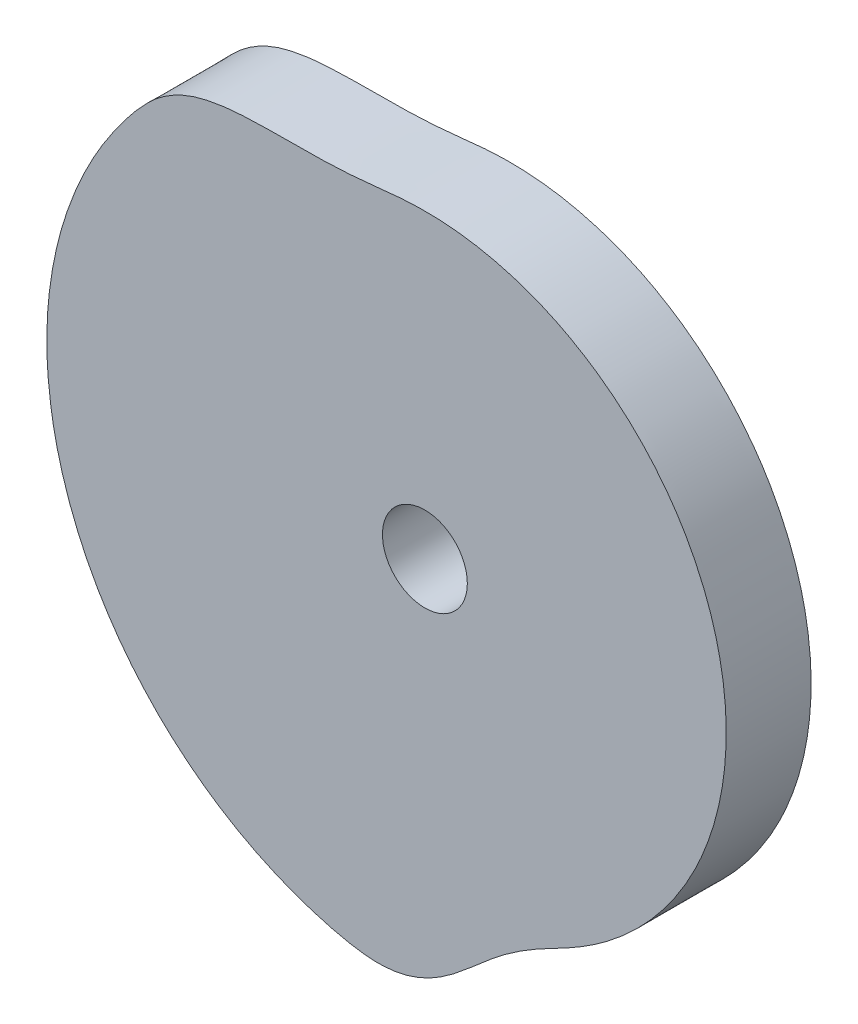
from build123d import *

# Parameters (mm, degrees)
SKETCH_1_R      = 10
EXTRUDE_1_DEPTH = 20


with BuildPart() as part:
    # 草图1 → 凸台-拉伸1 (new body)
    with BuildSketch(Plane.XY):
        with BuildLine():
            add(Edge.make_bspline(
                [(-55.64, -69.55), (-55.438072692, -69.711746946), (-55.028587824, -70.028203229), (-54.422364936, -70.514043862), (-53.798625861, -70.978190756), (-53.182107782, -71.453969938), (-52.549099836, -71.908791849), (-51.922508415, -72.370105147), (-51.291253069, -72.823230811), (-50.649377434, -73.259106602), (-50.008296576, -73.702367653), (-49.366891024, -74.138684997), (-48.713375963, -74.563395362), (-48.067007728, -74.989058095), (-47.407738113, -75.401723626), (-46.748284804, -75.812626567), (-46.083726707, -76.217298839), (-45.420757194, -76.623545995), (-44.747649559, -77.011728292), (-44.074066423, -77.397932034), (-43.396153141, -77.785057519), (-42.713672599, -78.157271781), (-42.030613475, -78.534073514), (-41.339344205, -78.888767981), (-40.65213613, -79.250771253), (-39.960248499, -79.603916517), (-39.261492289, -79.936236322), (-38.565896047, -80.285271505), (-37.863886563, -80.617834529), (-37.159747216, -80.953318034), (-36.452002287, -81.271225613), (-35.739415568, -81.578635341), (-35.029970337, -81.894412541), (-34.309383739, -82.188542724), (-33.592031011, -82.491589222), (-32.871808916, -82.781270726), (-32.146994805, -83.060827753), (-31.422152669, -83.342408661), (-30.689196931, -83.607774285), (-29.964253719, -83.885294388), (-29.224510345, -84.127134892), (-28.496752176, -84.393362771), (-27.756590493, -84.629814315), (-27.0217978, -84.872300672), (-26.276893409, -85.100767985), (-25.534252651, -85.329660019), (-24.788693319, -85.553717826), (-24.039624357, -85.758672938), (-23.291456808, -85.971950791), (-22.541289811, -86.171673425), (-21.786782319, -86.360446146), (-21.034358335, -86.550871279), (-20.283951593, -86.729212619), (-19.545602406, -86.903799806), (-18.812727809, -87.047135359), (-18.091102055, -87.2020318), (-17.378182015, -87.341635396), (-16.670771985, -87.461461134), (-15.973861595, -87.57003337), (-15.284694724, -87.673682734), (-14.603730698, -87.750452122), (-13.93046622, -87.821217763), (-13.267427426, -87.883401325), (-12.60690892, -87.921554161), (-11.956833048, -87.950796462), (-11.310205506, -87.973497801), (-10.669755457, -87.974960719), (-10.033476618, -87.946791161), (-9.4023194, -87.938572545), (-8.779629868, -87.879971202), (-8.159519676, -87.821576309), (-7.538730035, -87.753355845), (-6.921488325, -87.664527136), (-6.309196984, -87.550827731), (-5.702201823, -87.432254787), (-5.097670348, -87.303347612), (-4.494544832, -87.151288594), (-3.894614247, -86.983745709), (-3.294011687, -86.801595198), (-2.698871697, -86.599988563), (-2.099202446, -86.394612514), (-1.506310729, -86.162259361), (-0.918835639, -85.909441523), (-0.327748787, -85.655416133), (0.253560627, -85.367074794), (0.839985995, -85.083303534), (1.424063359, -84.780948774), (2.004746271, -84.46163504), (2.577268293, -84.121004651), (3.154734286, -83.781120262), (3.725243916, -83.42132734), (4.288490221, -83.037782118), (4.864671807, -82.664934067), (5.422587843, -82.255582652), (5.991659725, -81.853501396), (6.552149624, -81.429458533), (7.112012072, -80.999296448), (7.672318749, -80.563691028), (8.219505131, -80.105287289), (8.786683801, -79.661476494), (9.338713904, -79.18844662), (9.903334459, -78.720607629), (10.45946638, -78.239369787), (11.024005532, -77.757450492), (11.589478347, -77.269398225), (12.163303087, -76.780467917), (12.730736134, -76.277022596), (13.310556996, -75.776741305), (13.904129517, -75.281504454), (14.486663702, -74.765471326), (15.094557333, -74.272079559), (15.687225408, -73.756021475), (16.302440034, -73.258896339), (16.917817972, -72.756367618), (17.551275735, -72.271637809), (18.17800172, -71.776362842), (18.822343492, -71.298655676), (19.468745905, -70.817032231), (20.127449444, -70.349676026), (20.791050999, -69.891540386), (21.445971632, -69.425818513), (22.117891463, -68.990010507), (22.790954053, -68.56153945), (23.456182711, -68.125185865), (24.13627013, -67.722608815), (24.810612718, -67.321075129), (25.474484417, -66.917173597), (26.151153261, -66.542022955), (26.812641714, -66.159442075), (27.48064905, -65.801170948), (28.135379171, -65.440961239), (28.78606018, -65.092210149), (29.427205701, -64.747992736), (30.066271053, -64.425609143), (30.689682786, -64.089391531), (31.305822725, -63.761743026), (31.9151826, -63.440487826), (32.516244329, -63.135534782), (33.099262121, -62.818621583), (33.676336867, -62.515520841), (34.232886257, -62.202528391), (34.782863176, -61.901731724), (35.319115707, -61.588471081), (35.861059549, -61.284135445), (36.389519448, -60.95917733), (36.919856409, -60.639773994), (37.452549947, -60.320831565), (37.977954142, -59.992028724), (38.501921057, -59.659692774), (39.0218563, -59.324398462), (39.527618926, -58.964793846), (40.051463473, -58.633880587), (40.561290702, -58.283177475), (41.060187271, -57.915606266), (41.572173319, -57.564289651), (42.069104732, -57.188763089), (42.568656698, -56.822687663), (43.062885173, -56.45041354), (43.548909541, -56.068618713), (44.042640742, -55.694185514), (44.519573764, -55.2953199), (45.008724962, -54.916646903), (45.483010289, -54.516246754), (45.958522856, -54.122248179), (46.432563873, -53.723414018), (46.889409067, -53.305546907), (47.362481347, -52.903212739), (47.819365665, -52.482880898), (48.269110878, -52.055468314), (48.733146064, -51.647051252), (49.168818042, -51.205294876), (49.620056363, -50.783522126), (50.062266008, -50.3489475), (50.499165163, -49.912478114), (50.932867709, -49.469429425), (51.359364956, -49.019394061), (51.789732975, -48.572902328), (52.212355105, -48.118835331), (52.629404998, -47.66247657), (53.04286657, -47.199184692), (53.449192957, -46.729302558), (53.860556846, -46.263345161), (54.258644501, -45.788860902), (54.663749704, -45.3225523), (55.048287563, -44.838606366), (55.443712449, -44.362270049), (55.819207964, -43.869364898), (56.199781928, -43.379842116), (56.58041672, -42.892862805), (56.951533303, -42.397830292), (57.323901234, -41.901887535), (57.675986318, -41.390464601), (58.043181022, -40.888938056), (58.399668567, -40.382095335), (58.751025281, -39.872935573), (59.090388369, -39.354710259), (59.442399237, -38.845930547), (59.768658314, -38.319124412), (60.102569451, -37.798298178), (60.430701909, -37.272466371), (60.749754341, -36.739848189), (61.069385291, -36.209635692), (61.393321309, -35.6806017), (61.700725649, -35.142265266), (61.998755837, -34.59932393), (62.304125475, -34.060706127), (62.589226448, -33.509576681), (62.879586618, -32.959792717), (63.171704805, -32.412605395), (63.448663684, -31.859321048), (63.733648035, -31.310144332), (64.000835209, -30.751949253), (64.259421886, -30.1897347), (64.522163799, -29.627664049), (64.778978738, -29.064376763), (65.031732714, -28.497428205), (65.280402309, -27.931631511), (65.524936351, -27.360031375), (65.743453731, -26.779311715), (65.997283865, -26.212257976), (66.20828812, -25.629306745), (66.42977438, -25.049932864), (66.652198168, -24.472043126), (66.858621978, -23.889501591), (67.073636827, -23.309126445), (67.271262242, -22.721498479), (67.459687468, -22.129901557), (67.649670442, -21.539891964), (67.841321907, -20.95147884), (68.023598472, -20.358690553), (68.187559198, -19.762632836), (68.361540481, -19.167109369), (68.531358707, -18.571300272), (68.692039254, -17.971375888), (68.83880911, -17.369703837), (68.992332113, -16.771377203), (69.131294978, -16.166947758), (69.266633753, -15.562594734), (69.418077061, -14.959820909), (69.52251486, -14.351103036), (69.668963259, -13.749768665), (69.763807872, -13.138192394), (69.896648718, -12.53241823), (69.988230418, -11.919673693), (70.090797717, -11.306812643), (70.191733136, -10.694108842), (70.278774534, -10.079819533), (70.373068311, -9.467566164), (70.451258595, -8.853875014), (70.519550899, -8.236623067), (70.592339156, -7.623929161), (70.649100303, -7.006581399), (70.713157336, -6.390574742), (70.758431895, -5.769873224), (70.812780138, -5.153780163), (70.848817632, -4.536590582), (70.893243172, -3.920370889), (70.918374987, -3.299920854), (70.953241732, -2.680267513), (70.968620028, -2.059948344), (70.992271754, -1.440153936), (71.002277213, -0.820026917), (70.998617133, -0.200007171), (71.003254615, 0.420055601), (70.988362851, 1.03997291), (70.983292677, 1.660160255), (70.958586259, 2.276621063), (70.943031983, 2.893591447), (70.908384492, 3.509922241), (70.883227893, 4.130367967), (70.838630084, 4.749918825), (70.802224146, 5.370385012), (70.752598592, 5.987212448), (70.688957878, 6.603233182), (70.629574114, 7.219956031), (70.572699657, 7.837292989), (70.501345874, 8.453920459), (70.41948185, 9.066590172), (70.343137119, 9.680905867), (70.247420376, 10.292953439), (70.164150221, 10.907820813), (70.05850411, 11.519763476), (69.962219239, 12.130938865), (69.851848669, 12.740991342), (69.729474761, 13.349898219), (69.610758277, 13.956812412), (69.491139085, 14.564257592), (69.360422578, 15.166763461), (69.23030958, 15.77412838), (69.093574734, 16.3783357), (68.938571128, 16.979643204), (68.792559412, 17.581515101), (68.629737168, 18.179948186), (68.468273016, 18.779496694), (68.317504959, 19.38073234), (68.124675013, 19.967439879), (67.964795307, 20.566792251), (67.767395919, 21.154838572), (67.592464556, 21.751799931), (67.402512005, 22.338622471), (67.200473278, 22.924679362), (66.987780562, 23.504695995), (66.79595652, 24.094578194), (66.564708466, 24.666799494), (66.366419151, 25.254964339), (66.124586373, 25.826603598), (65.917571391, 26.412347373), (65.665884147, 26.981658996), (65.43189083, 27.557425722), (65.194240145, 28.129969032), (64.935912344, 28.691518996), (64.694861251, 29.260364449), (64.428242806, 29.819191516), (64.172295722, 30.382663021), (63.898306323, 30.939177456), (63.634490137, 31.500542522), (63.348415284, 32.049202296), (63.071859957, 32.602683958), (62.77921335, 33.149596558), (62.491929151, 33.697675855), (62.199807362, 34.246901134), (61.893180931, 34.783260735), (61.587926865, 35.324032162), (61.283683346, 35.860803807), (60.959298175, 36.389587807), (60.639741622, 36.919838097), (60.320840324, 37.452554902), (59.992026405, 37.97795283), (59.659693398, 38.50192141), (59.324398295, 39.021856205), (58.964793891, 39.527618951), (58.633880575, 40.051463466), (58.283177478, 40.561290704), (57.915606266, 41.06018727), (57.564289651, 41.572173319), (57.188763089, 42.069104732), (56.822687663, 42.568656698), (56.45041354, 43.062885173), (56.068618713, 43.548909541), (55.694185514, 44.042640742), (55.2953199, 44.519573764), (54.916646903, 45.008724962), (54.516246754, 45.483010289), (54.122248179, 45.958522856), (53.723414018, 46.432563873), (53.305546907, 46.889409067), (52.903212739, 47.362481347), (52.482880898, 47.819365665), (52.055468314, 48.269110878), (51.647051252, 48.733146064), (51.205294876, 49.168818042), (50.783522126, 49.620056363), (50.3489475, 50.062266008), (49.912478114, 50.499165163), (49.469429425, 50.932867709), (49.019394061, 51.359364956), (48.572902328, 51.789732975), (48.118835331, 52.212355105), (47.66247657, 52.629404998), (47.199184692, 53.04286657), (46.729302558, 53.449192957), (46.263345161, 53.860556846), (45.788860902, 54.258644501), (45.3225523, 54.663749704), (44.838606366, 55.048287563), (44.362270049, 55.443712449), (43.869364898, 55.819207964), (43.379842116, 56.199781928), (42.892862805, 56.58041672), (42.397830292, 56.951533303), (41.901887535, 57.323901234), (41.390464601, 57.675986318), (40.888938056, 58.043181022), (40.382095335, 58.399668567), (39.872935573, 58.751025281), (39.354710259, 59.090388369), (38.845930547, 59.442399237), (38.319124412, 59.768658314), (37.798298178, 60.102569451), (37.272466371, 60.430701909), (36.739848189, 60.749754341), (36.209635692, 61.069385291), (35.6806017, 61.393321309), (35.142265266, 61.700725649), (34.59932393, 61.998755837), (34.060706127, 62.304125475), (33.509576681, 62.589226448), (32.959792717, 62.879586618), (32.412605395, 63.171704805), (31.859321048, 63.448663684), (31.310144332, 63.733648035), (30.751949253, 64.000835209), (30.1897347, 64.259421886), (29.627664049, 64.522163799), (29.064376763, 64.778978738), (28.497428205, 65.031732714), (27.931631511, 65.280402309), (27.360031375, 65.524936351), (26.779311715, 65.743453732), (26.212257976, 65.997283863), (25.629306747, 66.208288129), (25.049932855, 66.429774348), (24.47204316, 66.652198288), (23.889501463, 66.858621532), (23.309126922, 67.073638497), (22.721496683, 67.271255954), (22.129908221, 67.459710796), (21.539867088, 67.649583368), (20.951571489, 67.841646214), (20.36141121, 68.02145487), (19.767019562, 68.191245842), (19.169837801, 68.359423602), (18.571393532, 68.531684078), (17.971355274, 68.69197084), (17.36969368, 68.838759711), (16.771438339, 68.992597698), (16.169879569, 69.129558602), (15.56664396, 69.269729012), (14.962776024, 69.416453731), (14.351168236, 69.522797702), (13.749751102, 69.668887072), (13.138197136, 69.763828441), (12.532416966, 69.896643235), (11.919674031, 69.988231883), (11.306812551, 70.090797318), (10.694108867, 70.191733241), (10.079819527, 70.278774506), (9.467566166, 70.373068319), (8.853875014, 70.451258593), (8.236623067, 70.5195509), (7.62392916, 70.592339156), (7.006581399, 70.649100303), (6.390574742, 70.713157336), (5.769873224, 70.758431895), (5.153780163, 70.812780138), (4.536590582, 70.848817632), (3.920370889, 70.893243172), (3.299920854, 70.918374987), (2.680267513, 70.953241732), (2.059948344, 70.968620028), (1.440153936, 70.992271753), (0.820026917, 71.002277213), (0.200007171, 70.998617132), (-0.420055602, 71.003254619), (-1.039972908, 70.988362835), (-1.660160261, 70.983292736), (-2.276621043, 70.958586042), (-2.893591524, 70.943032785), (-3.509921951, 70.908381442), (-4.13036905, 70.883239274), (-4.749914778, 70.838587572), (-5.370400122, 70.802382878), (-5.997078492, 70.751198688), (-6.633151054, 70.688108671), (-7.287287773, 70.632974966), (-7.949166028, 70.554853137), (-8.628017278, 70.50648859), (-9.315582255, 70.413116172), (-10.020907429, 70.355275958), (-10.735715889, 70.264217649), (-11.467271836, 70.202591573), (-12.21001146, 70.120153875), (-12.965876579, 70.035320695), (-13.730749227, 69.974316496), (-14.505942528, 69.885978556), (-15.292836222, 69.817029928), (-16.093879816, 69.763465732), (-16.902785254, 69.686587582), (-17.722980683, 69.627844606), (-18.550026432, 69.580416959), (-19.386655404, 69.529908812), (-20.22967306, 69.47709918), (-21.083389483, 69.441202969), (-21.939740327, 69.397013428), (-22.803356477, 69.370508527), (-23.673334647, 69.340074968), (-24.549844369, 69.308247876), (-25.433230286, 69.286753021), (-26.316795529, 69.284441365), (-27.206540614, 69.255660827), (-28.096691213, 69.252193009), (-28.993287493, 69.235740467), (-29.89004617, 69.244810162), (-30.789953742, 69.225052049), (-31.690046276, 69.234982146), (-32.58995374, 69.215018849), (-33.490046176, 69.224942974), (-34.389954142, 69.205208751), (-35.286711347, 69.214189193), (-36.183313081, 69.198067528), (-37.073443304, 69.19336347), (-37.963319427, 69.169124807), (-38.846660721, 69.149817474), (-39.726811057, 69.132087401), (-40.596920127, 69.102620199), (-41.459923203, 69.058491624), (-42.317044362, 69.023704393), (-43.163216106, 68.968295124), (-44.000915662, 68.925992062), (-44.826522006, 68.848141394), (-45.643998571, 68.78389512), (-46.44709729, 68.700860457), (-47.238257344, 68.615751572), (-48.013296874, 68.499629155), (-48.777626994, 68.393093159), (-49.527621767, 68.272249985), (-50.26438546, 68.142565946), (-50.989309947, 68.005783855), (-51.69323846, 67.839646649), (-52.389939765, 67.686521649), (-53.063380084, 67.500126111), (-53.730145914, 67.325470228), (-54.375675146, 67.123810157), (-55.008399837, 66.911842066), (-55.631227702, 66.695447914), (-56.23384374, 66.451307747), (-56.832008527, 66.215850995), (-57.406738075, 65.950056681), (-57.983885788, 65.691748916), (-58.550485106, 65.416995002), (-59.09650111, 65.109718637), (-59.643516784, 64.815172516), (-60.171117774, 64.488453599), (-60.703501442, 64.163955759), (-61.220518625, 63.812164987), (-61.731787804, 63.449203237), (-62.243787379, 63.082851272), (-62.745455848, 62.690053025), (-63.238106275, 62.277766765), (-63.748437653, 61.873733196), (-64.230975043, 61.427651131), (-64.725541744, 60.979297714), (-65.211829828, 60.511895446), (-65.691853501, 60.028518092), (-66.179086962, 59.535512524), (-66.65806065, 59.021328932), (-67.149383606, 58.498402815), (-67.617573442, 57.947888115), (-68.110234855, 57.398700544), (-68.577313471, 56.814956285), (-69.076861518, 56.241746374), (-69.55180268, 55.63804437), (-70.029094686, 55.029315516), (-70.513804381, 54.422169449), (-70.978254982, 53.798678289), (-71.453952678, 53.182093693), (-71.90879648, 52.549103616), (-72.370103917, 51.922507411), (-72.823231141, 51.291253338), (-73.259106513, 50.649377362), (-73.702367677, 50.008296596), (-74.13868499, 49.366891019), (-74.563395364, 48.713375965), (-74.989058095, 48.067007727), (-75.401723626, 47.407738113), (-75.812626567, 46.748284804), (-76.217298839, 46.083726707), (-76.623545995, 45.420757194), (-77.011728292, 44.747649559), (-77.397932034, 44.074066423), (-77.785057519, 43.396153141), (-78.157271781, 42.713672599), (-78.534073514, 42.030613475), (-78.888767981, 41.339344205), (-79.250771253, 40.65213613), (-79.603916517, 39.960248499), (-79.936236322, 39.261492289), (-80.285271505, 38.565896047), (-80.617834529, 37.863886563), (-80.953318034, 37.159747216), (-81.271225613, 36.452002287), (-81.578635341, 35.739415568), (-81.894412541, 35.029970337), (-82.188542724, 34.309383739), (-82.491589222, 33.592031011), (-82.781270726, 32.871808916), (-83.060827753, 32.146994805), (-83.342408661, 31.422152669), (-83.607774285, 30.689196931), (-83.885294388, 29.964253719), (-84.127134891, 29.224510345), (-84.393362772, 28.496752176), (-84.629814313, 27.756590492), (-84.872300679, 27.021797802), (-85.10076796, 26.276893402), (-85.329660115, 25.534252678), (-85.553717471, 24.788693221), (-85.758674274, 24.039624728), (-85.971945811, 23.291455426), (-86.171691913, 22.541294943), (-86.360377024, 21.786763134), (-86.551928089, 21.031287421), (-86.7304754, 20.274207425), (-86.90042329, 19.516763596), (-87.071808576, 18.761125221), (-87.231866895, 18.001052057), (-87.380276812, 17.236717566), (-87.530541137, 16.474082289), (-87.673549705, 15.707868774), (-87.797267681, 14.942874951), (-87.934429907, 14.177930358), (-88.047536516, 13.409626538), (-88.17566969, 12.64177061), (-88.268846193, 11.869822496), (-88.368832549, 11.099875516), (-88.476173856, 10.328157402), (-88.548215329, 9.553124116), (-88.628920815, 8.77991355), (-88.716062306, 8.007816099), (-88.768315821, 7.233177832), (-88.829422397, 6.456648225), (-88.895315627, 5.684097595), (-88.928069002, 4.906555406), (-88.973410914, 4.130308308), (-88.998327448, 3.353262191), (-89.032529292, 2.576870726), (-89.05218989, 1.800091835), (-89.058756979, 1.023320182), (-89.072534545, 0.246709803), (-89.071232474, -0.530028902), (-89.062528332, -1.310119664), (-89.038746598, -2.086631599), (-89.023006593, -2.863537974), (-88.98851736, -3.63994462), (-88.962876214, -4.41694147), (-88.920757426, -5.193570616), (-88.873030496, -5.967123697), (-88.808193584, -6.743195635), (-88.752871156, -7.517174488), (-88.681486559, -8.293815074), (-88.599299652, -9.066585615), (-88.52325585, -9.840734918), (-88.427718147, -10.609719041), (-88.345735781, -11.381605732), (-88.228568281, -12.149817545), (-88.11986163, -12.919972943), (-88.011916915, -13.6907783), (-87.892390178, -14.457603928), (-87.760906104, -15.224087093), (-87.620309829, -15.986725558), (-87.480592873, -16.754064895), (-87.333376761, -17.518035076), (-87.168813959, -18.279755261), (-87.011774643, -19.041090192), (-86.843591654, -19.798289256), (-86.656917556, -20.552591762), (-86.484631851, -21.308621285), (-86.287904318, -22.059467511), (-86.103201145, -22.815932919), (-85.892260946, -23.563988804), (-85.677819576, -24.312712508), (-85.471915336, -25.061497601), (-85.252537659, -25.808438312), (-85.02188368, -26.551669277), (-84.778434725, -27.289483289), (-84.544696408, -28.029345291), (-84.286406842, -28.762116562), (-84.043894816, -29.499156598), (-83.78132273, -30.231711679), (-83.508768886, -30.959536407), (-83.243862871, -31.689389396), (-82.958985699, -32.414262349), (-82.670914789, -33.137015381), (-82.384423886, -33.859874739), (-82.076160689, -34.57172572), (-81.7839844, -35.289770816), (-81.47099474, -36.001942327), (-81.148880044, -36.709488002), (-80.833586944, -37.41984456), (-80.500918173, -38.122053318), (-80.159066253, -38.819541509), (-79.82154564, -39.522401108), (-79.471537902, -40.217450993), (-79.120340946, -40.911866907), (-78.764212932, -41.600708401), (-78.385229927, -42.280741765), (-78.02775653, -42.9694503), (-77.635218451, -43.640657152), (-77.264096836, -44.320881107), (-76.870434491, -44.992250645), (-76.468740558, -45.659230298), (-76.074293373, -46.331318248), (-75.658141597, -46.988844697), (-75.254272503, -47.651481371), (-74.828631243, -48.299128457), (-74.410786607, -48.952679434), (-73.980232304, -49.602400693), (-73.541592535, -50.247736532), (-73.103653415, -50.891570882), (-72.648628897, -51.519024817), (-72.201185446, -52.153263373), (-71.738631262, -52.778996444), (-71.283529121, -53.411764447), (-70.811718383, -54.027994702), (-70.340045695, -54.64262348), (-69.859627524, -55.252356481), (-69.37275965, -55.858904694), (-68.879464548, -56.459566187), (-68.389688642, -57.062475207), (-67.892604757, -57.66171438), (-67.381930106, -58.2483545), (-66.870036563, -58.832993401), (-66.349282986, -59.409357384), (-65.832991534, -59.989372584), (-65.308822245, -60.56197221), (-64.782780872, -61.132461509), (-64.239142529, -61.689189518), (-63.699129854, -62.252366433), (-63.156318297, -62.80967001), (-62.595689212, -63.348987915), (-62.05262301, -63.902696967), (-61.491870033, -64.442199585), (-60.919210805, -64.969150874), (-60.352840211, -65.499740026), (-59.779210169, -66.022825545), (-59.199129806, -66.539019118), (-58.62220208, -67.062942744), (-58.032136058, -67.569185202), (-57.43862479, -68.072315949), (-56.842980099, -68.570293391), (-56.23896636, -69.058717007), (-55.841524728, -69.388575527), (-55.64, -69.55)],
                knots=[0, 0, 0, 0, 0.001542652, 0.003085303, 0.004631535, 0.006177767, 0.007728081, 0.009278395, 0.010817073, 0.01236062, 0.013904168, 0.015464133, 0.016985515, 0.018551041, 0.020078382, 0.021622569, 0.023183673, 0.024717466, 0.026258196, 0.027816134, 0.029346963, 0.030912489, 0.032451038, 0.033997781, 0.035544524, 0.037082175, 0.03862879, 0.040157553, 0.041722069, 0.043260105, 0.044807869, 0.046347573, 0.047887278, 0.049437464, 0.05098765, 0.052530302, 0.054065639, 0.055619516, 0.057166386, 0.058713257, 0.060246792, 0.061805618, 0.063332829, 0.064878934, 0.066419023, 0.067978102, 0.069512409, 0.071060301, 0.072608193, 0.074150844, 0.075688495, 0.077245419, 0.07877831, 0.080287309, 0.081768436, 0.083230101, 0.084687842, 0.086099329, 0.087507595, 0.08889324, 0.090254005, 0.091592823, 0.092929722, 0.094223988, 0.095537039, 0.096809607, 0.098081555, 0.099354124, 0.100606829, 0.101843028, 0.103080984, 0.104321013, 0.105566127, 0.106798006, 0.108033566, 0.109253686, 0.110482836, 0.11174136, 0.112967293, 0.114224247, 0.115487626, 0.11674615, 0.11801965, 0.119301034, 0.120581031, 0.121887598, 0.123185368, 0.124501874, 0.125838034, 0.127157087, 0.128496937, 0.129858428, 0.131219918, 0.132587632, 0.133983077, 0.13537427, 0.136777478, 0.138192877, 0.139605203, 0.141032967, 0.142485959, 0.14393895, 0.145404798, 0.146870645, 0.148364518, 0.149858391, 0.151365294, 0.152887195, 0.154424203, 0.155974135, 0.157526359, 0.15909138, 0.160658923, 0.162241886, 0.16382809, 0.165414294, 0.167004229, 0.168610107, 0.170220407, 0.17181926, 0.173418114, 0.175011151, 0.176593366, 0.17817558, 0.179753671, 0.181304494, 0.182855317, 0.184386146, 0.185916974, 0.187411111, 0.188905248, 0.190372442, 0.191812738, 0.193243817, 0.194639687, 0.196035557, 0.19740457, 0.198746776, 0.200053797, 0.201360817, 0.20263292, 0.203860624, 0.205098101, 0.206335578, 0.207566014, 0.208796449, 0.210026884, 0.211267708, 0.212491706, 0.213726468, 0.214955779, 0.21619054, 0.217419851, 0.218644333, 0.219884998, 0.221121198, 0.222357398, 0.223577679, 0.224810039, 0.226042399, 0.227271549, 0.228516188, 0.229729978, 0.230971757, 0.232198334, 0.233422977, 0.234662528, 0.235900484, 0.237123836, 0.238361792, 0.239584499, 0.240821497, 0.242044204, 0.243280883, 0.24450359, 0.245740588, 0.246977586, 0.248200939, 0.249438895, 0.250663538, 0.251903089, 0.253142639, 0.254369216, 0.255595793, 0.256824943, 0.258054094, 0.259286454, 0.260518813, 0.261751173, 0.262971455, 0.264207654, 0.26544832, 0.266672802, 0.267913467, 0.269142778, 0.270360953, 0.271606702, 0.2728307, 0.274054698, 0.275295522, 0.276525958, 0.277756393, 0.278986828, 0.280224305, 0.281452009, 0.282679712, 0.283915433, 0.285151153, 0.286386874, 0.287613451, 0.288840028, 0.290075589, 0.291302649, 0.292529709, 0.293774823, 0.294993647, 0.296230645, 0.297459796, 0.298699824, 0.299928974, 0.301161815, 0.302394655, 0.303627496, 0.304853428, 0.306079361, 0.307317477, 0.308549356, 0.309781234, 0.311013113, 0.312239046, 0.313478437, 0.314698719, 0.315938109, 0.317172231, 0.318401381, 0.319630532, 0.320855014, 0.322098858, 0.323323341, 0.324558901, 0.325779021, 0.3270109, 0.32824646, 0.329474968, 0.330703476, 0.3319516, 0.333177049, 0.334402499, 0.335644913, 0.336865195, 0.338105223, 0.339323399, 0.340561355, 0.341797555, 0.343033754, 0.344248683, 0.345483445, 0.346717086, 0.347950727, 0.349183567, 0.350416408, 0.351648768, 0.352880967, 0.354113167, 0.355345526, 0.356577886, 0.357810727, 0.359023703, 0.360257344, 0.361490986, 0.362725747, 0.363960508, 0.365196708, 0.366414884, 0.36765284, 0.368890796, 0.370111077, 0.371353492, 0.372576198, 0.373801648, 0.375046762, 0.37627527, 0.377503777, 0.378735656, 0.379971217, 0.381206778, 0.382422844, 0.383662394, 0.384882514, 0.386126358, 0.387355509, 0.388584659, 0.389818781, 0.391052902, 0.392287023, 0.393512956, 0.394733237, 0.395984049, 0.397209981, 0.39844186, 0.39966117, 0.400905809, 0.402125119, 0.403357959, 0.404583892, 0.40582392, 0.40705676, 0.408285911, 0.409533402, 0.410762552, 0.411981376, 0.413218375, 0.414445435, 0.415672495, 0.416908055, 0.418143616, 0.419370193, 0.42059677, 0.421832491, 0.423068211, 0.424286387, 0.425541139, 0.426751508, 0.427988985, 0.429219421, 0.430449856, 0.431680291, 0.432921115, 0.434145113, 0.435379875, 0.436609186, 0.437843947, 0.439073258, 0.44029774, 0.441538405, 0.442774605, 0.444010805, 0.445231086, 0.446463446, 0.447695806, 0.448924956, 0.450169595, 0.451383385, 0.452625164, 0.453851741, 0.455076384, 0.456315935, 0.457553891, 0.458777243, 0.460015199, 0.461237906, 0.462474904, 0.463697611, 0.46493429, 0.466156997, 0.467393995, 0.468630993, 0.469854346, 0.471092302, 0.472316945, 0.473556496, 0.474796046, 0.476022623, 0.4772492, 0.47847835, 0.479707501, 0.480939861, 0.48217222, 0.48340458, 0.484624862, 0.485861061, 0.487101726, 0.488326209, 0.489566874, 0.490796185, 0.49201436, 0.493260109, 0.494484107, 0.495708105, 0.496948929, 0.498179365, 0.4994098, 0.500640235, 0.501877712, 0.503105416, 0.504333119, 0.50556884, 0.50680456, 0.508040281, 0.509266858, 0.510493435, 0.511728996, 0.512956056, 0.514183116, 0.51542823, 0.516647054, 0.517884052, 0.519113203, 0.520353231, 0.521582381, 0.522815222, 0.524048062, 0.525280903, 0.526506835, 0.527732768, 0.528970884, 0.530202763, 0.531434641, 0.53266652, 0.533892453, 0.535112735, 0.536352126, 0.537591516, 0.538825638, 0.540054788, 0.541283939, 0.542508421, 0.543732903, 0.544976747, 0.546212308, 0.547432428, 0.548664307, 0.549899867, 0.551128375, 0.552356883, 0.553605007, 0.554830456, 0.556055906, 0.55729832, 0.558518602, 0.55975863, 0.560976806, 0.562214762, 0.563450962, 0.564687161, 0.56590209, 0.567136852, 0.568370493, 0.569604134, 0.570836974, 0.572069815, 0.573302175, 0.574534374, 0.575766574, 0.576998933, 0.578231293, 0.579464133, 0.58067711, 0.581910751, 0.583144392, 0.584379154, 0.585613915, 0.586850115, 0.58812764, 0.589424954, 0.590763772, 0.592100671, 0.593481176, 0.594899085, 0.596319081, 0.597776552, 0.599275571, 0.600774591, 0.602311214, 0.603849763, 0.605425975, 0.607020375, 0.608636185, 0.610270225, 0.611922772, 0.61357532, 0.615267546, 0.616958721, 0.618669749, 0.620379969, 0.62211005, 0.623859995, 0.625609375, 0.627378289, 0.629127669, 0.630916456, 0.63268537, 0.634474047, 0.636262834, 0.63805151, 0.639840297, 0.641628974, 0.643417761, 0.645206438, 0.646975352, 0.648764139, 0.650513519, 0.652282768, 0.654032148, 0.65576223, 0.657473258, 0.659184285, 0.660876511, 0.662529059, 0.664184472, 0.665820083, 0.667417948, 0.668998164, 0.67056369, 0.672089867, 0.673599389, 0.675092601, 0.676550342, 0.677996795, 0.679404499, 0.68080249, 0.682162093, 0.683513684, 0.684833485, 0.686140959, 0.687443742, 0.68870962, 0.689972843, 0.691217957, 0.692480085, 0.693725199, 0.694952903, 0.696183338, 0.697424162, 0.698669911, 0.699910576, 0.701162807, 0.702423056, 0.703708134, 0.704993212, 0.706302044, 0.707624238, 0.708973635, 0.710322739, 0.711685969, 0.713105966, 0.714512407, 0.715963222, 0.717414038, 0.718910288, 0.720419287, 0.72194637, 0.723489021, 0.725031673, 0.726577905, 0.728124137, 0.729674451, 0.731224765, 0.732763443, 0.73430699, 0.735850538, 0.737410503, 0.738931885, 0.74049741, 0.742024751, 0.743568939, 0.745130043, 0.746663836, 0.748204566, 0.749762504, 0.751293333, 0.752858858, 0.754397408, 0.755944151, 0.757490894, 0.759028544, 0.760575159, 0.762103922, 0.763668439, 0.765206475, 0.766754239, 0.768293943, 0.769833647, 0.771383834, 0.77293402, 0.774476672, 0.776012009, 0.777565886, 0.779112756, 0.780659627, 0.782193162, 0.783751987, 0.785279199, 0.786825303, 0.788365393, 0.789924471, 0.791458779, 0.793006671, 0.794554562, 0.796097214, 0.797634865, 0.799191789, 0.800744012, 0.802272387, 0.803820151, 0.805363699, 0.806903275, 0.808462354, 0.809998205, 0.811550174, 0.81308255, 0.814631334, 0.816180119, 0.817723283, 0.819266446, 0.82080961, 0.822367928, 0.823906478, 0.825445027, 0.826999793, 0.828534745, 0.830089511, 0.831621886, 0.83317411, 0.834725443, 0.836256916, 0.837807612, 0.839357926, 0.840888367, 0.842438553, 0.843988867, 0.845539563, 0.847070392, 0.848621724, 0.850173057, 0.851705433, 0.853258801, 0.854793752, 0.856348518, 0.857885141, 0.85944346, 0.860982009, 0.862522739, 0.864063469, 0.865609318, 0.867155167, 0.868701016, 0.8702498, 0.871782176, 0.873337577, 0.874873428, 0.876432507, 0.877976055, 0.879519602, 0.881067366, 0.882600258, 0.884152481, 0.885690132, 0.887227782, 0.888794821, 0.890323584, 0.891871476, 0.893424844, 0.894964933, 0.896511037, 0.898057142, 0.899590677, 0.901143028, 0.902683117, 0.904229987, 0.905776858, 0.907312195, 0.908873299, 0.910415951, 0.911947811, 0.913497997, 0.915037702, 0.916585466, 0.91813323, 0.919671266, 0.921217881, 0.922764496, 0.924319897, 0.925857548, 0.927404291, 0.92894284, 0.930498876, 0.932029704, 0.933577851, 0.935118581, 0.936669404, 0.938220228, 0.939764415, 0.941308602, 0.942846638, 0.944384674, 0.945933586, 0.947493551, 0.949037099, 0.950575777, 0.952114454, 0.953664768, 0.955215082, 0.956761314, 0.958291756, 0.959834407, 0.961389427, 0.962929003, 0.964468579, 0.966020803, 0.967570735, 0.969105686, 0.970653832, 0.972201979, 0.973735386, 0.975282256, 0.97682836, 0.978374465, 0.97993443, 0.98146629, 0.983012139, 0.984558243, 0.986105114, 0.987651984, 0.989185391, 0.990733538, 0.992281684, 0.993831616, 0.995368624, 0.996920848, 0.998460424, 1, 1, 1, 1], degree=3))
        make_face()
        Circle(SKETCH_1_R, mode=Mode.SUBTRACT)
    extrude(amount=EXTRUDE_1_DEPTH)


solid = part.part
